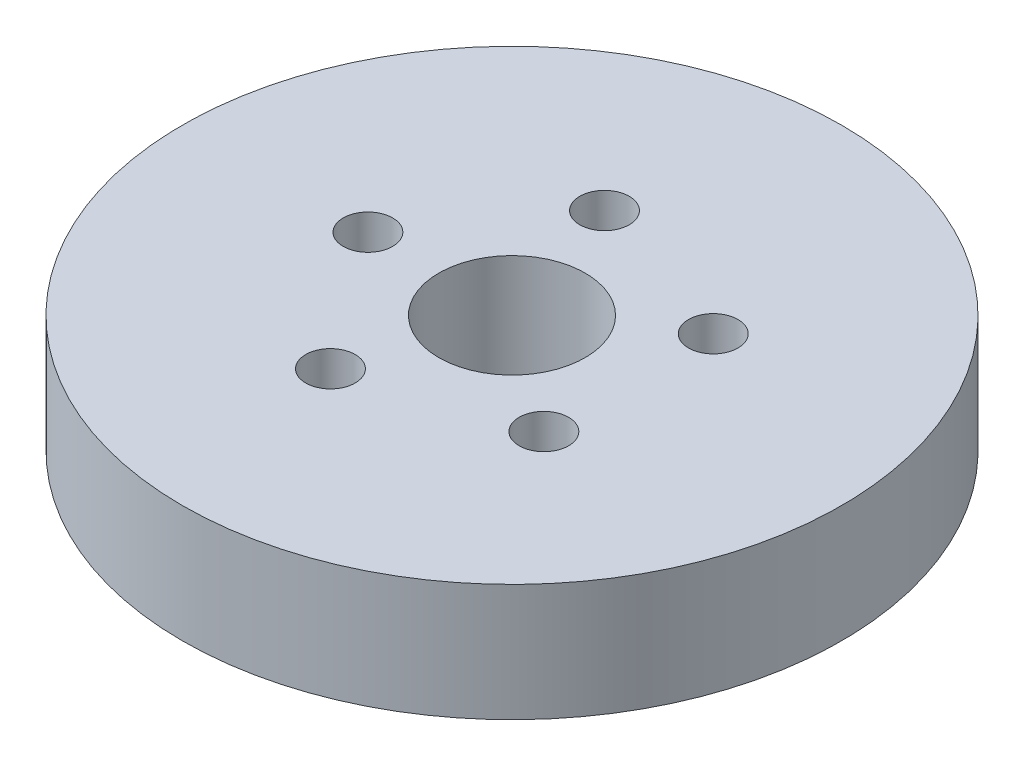
from build123d import *

# Parameters (mm, degrees)
SKETCH1_R           = 67.5
BOSS_EXTRUDE1_DEPTH = 24
SKETCH2_R           = 15
CUT_EXTRUDE1_DEPTH  = 99.430178299
SKETCH3_R           = 5.065349231
CUT_EXTRUDE2_DEPTH  = 21.481602698
CIRPATTERN1_COUNT   = 5


with BuildPart() as part:
    # Sketch1 → Boss-Extrude1 (new body)
    with BuildSketch(Plane(origin=(0, 0, 0), x_dir=(1, 0, 0), z_dir=(0, 1, 0))):
        Circle(SKETCH1_R)
    extrude(amount=BOSS_EXTRUDE1_DEPTH)

    # Sketch2 → Cut-Extrude1 (cut, through all)
    with BuildSketch(Plane(origin=(0, 0, 0), x_dir=(1, 0, 0), z_dir=(0, 1, 0))):
        Circle(SKETCH2_R)
    extrude(amount=CUT_EXTRUDE1_DEPTH, mode=Mode.SUBTRACT)

    # Sketch3 → Cut-Extrude2 (cut)
    with BuildSketch(Plane(origin=(0, 24, 0), x_dir=(1, 0, 0), z_dir=(0, 1, 0))):
        with Locations((-29.511235222, 0)):
            Circle(SKETCH3_R)
    cut_extrude2 = extrude(amount=-CUT_EXTRUDE2_DEPTH, mode=Mode.SUBTRACT)

    # CirPattern1: Cut-Extrude2 ×5 about axis
    cirpattern1_axis = Axis((0, 0, 0), (0, 1, 0))
    for i in range(1, CIRPATTERN1_COUNT):
        add(cut_extrude2.rotate(cirpattern1_axis, i * 360 / CIRPATTERN1_COUNT), mode=Mode.SUBTRACT)


solid = part.part
